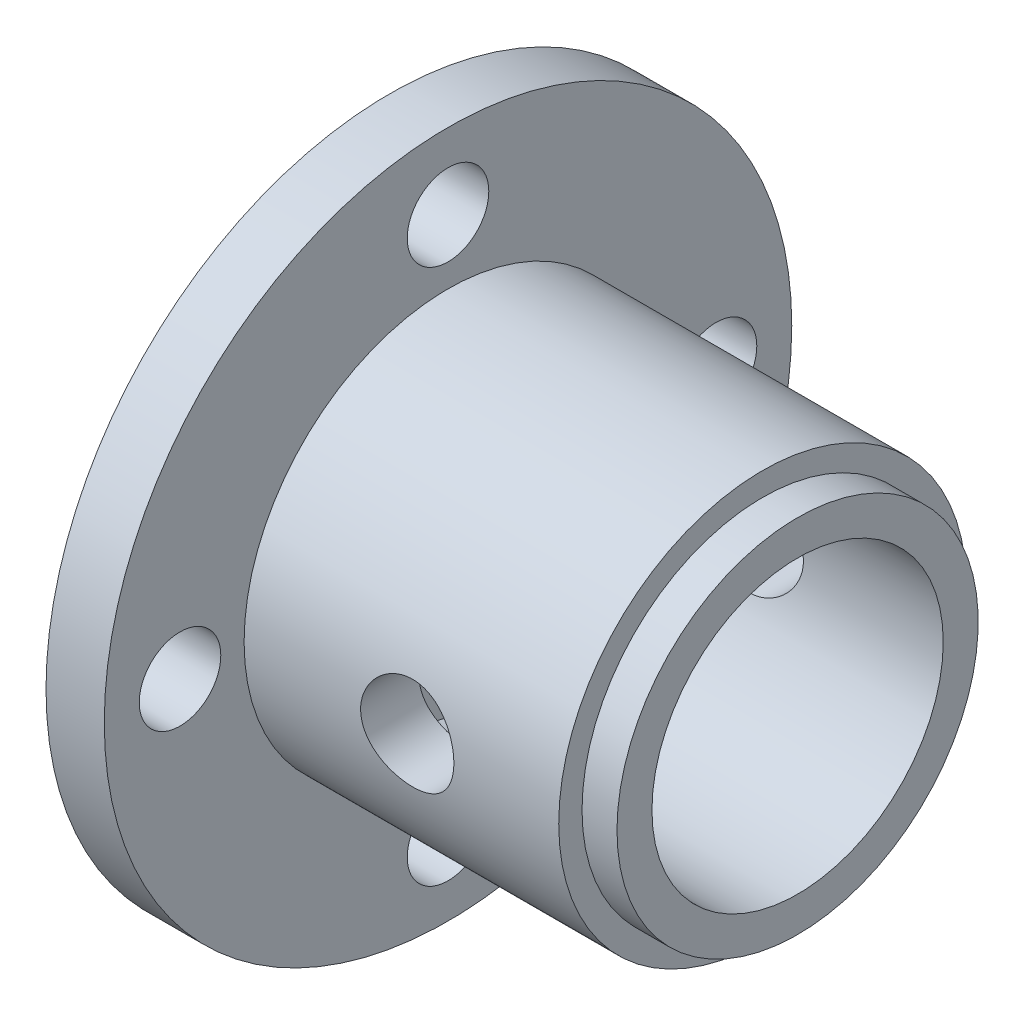
from build123d import *

# Parameters (mm, degrees)
CUT_EXTRUDE1_REACH      = 53.386
SKETCH2_R               = 3.5
CUT_EXTRUDE2_DEPTH      = 46.84212037
CUT_EXTRUDE2_DEPTH_BACK = 46.84212037
SKETCH3_R               = 4


# Read off the part's stored shape, not the designer's step: Revolve1
with BuildPart() as part:
    # Revolve1 outline → Revolve1 (revolve)
    with BuildSketch(Plane.YX):
        Polygon((0, -9), (0, -19), (7.5, -19), (7.5, -16), (29.5, -16), (29.5, -11), (17.5, -11), (17.5, 16), (15.5, 16), (15.5, 19), (12.5, 19), (12.5, -9), align=None)
    revolve(axis=Axis((0, 0, 0), (1, 0, 0)))

    # Sketch2 → Cut-Extrude1 (cut, up to next)
    with BuildSketch(Plane(origin=(-11, 0, 0), x_dir=(0, 0, -1), z_dir=(1, 0, 0)), mode=Mode.PRIVATE) as cut_extrude1_sk1:
        with Locations((0, 23)):
            Circle(SKETCH2_R)
    cut_extrude1_tool1 = extrude(cut_extrude1_sk1.sketch, amount=-CUT_EXTRUDE1_REACH, mode=Mode.PRIVATE) & part.part
    # Sketch2 → Cut-Extrude1 (cut, up to next)
    with BuildSketch(Plane(origin=(-11, 0, 0), x_dir=(0, 0, -1), z_dir=(1, 0, 0)), mode=Mode.PRIVATE) as cut_extrude1_sk2:
        with Locations((23, 0)):
            Circle(SKETCH2_R)
    cut_extrude1_tool2 = extrude(cut_extrude1_sk2.sketch, amount=-CUT_EXTRUDE1_REACH, mode=Mode.PRIVATE) & part.part
    # Sketch2 → Cut-Extrude1 (cut, up to next)
    with BuildSketch(Plane(origin=(-11, 0, 0), x_dir=(0, 0, -1), z_dir=(1, 0, 0)), mode=Mode.PRIVATE) as cut_extrude1_sk3:
        with Locations((0, -23)):
            Circle(SKETCH2_R)
    cut_extrude1_tool3 = extrude(cut_extrude1_sk3.sketch, amount=-CUT_EXTRUDE1_REACH, mode=Mode.PRIVATE) & part.part
    # Sketch2 → Cut-Extrude1 (cut, up to next)
    with BuildSketch(Plane(origin=(-11, 0, 0), x_dir=(0, 0, -1), z_dir=(1, 0, 0)), mode=Mode.PRIVATE) as cut_extrude1_sk4:
        with Locations((-23, 0)):
            Circle(SKETCH2_R)
    cut_extrude1_tool4 = extrude(cut_extrude1_sk4.sketch, amount=-CUT_EXTRUDE1_REACH, mode=Mode.PRIVATE) & part.part
    add(cut_extrude1_tool1.solids().sort_by_distance((-11, 23, 0))[0], mode=Mode.SUBTRACT)
    add(cut_extrude1_tool2.solids().sort_by_distance((-11, 0, -23))[0], mode=Mode.SUBTRACT)
    add(cut_extrude1_tool3.solids().sort_by_distance((-11, -23, 0))[0], mode=Mode.SUBTRACT)
    add(cut_extrude1_tool4.solids().sort_by_distance((-11, 0, 23))[0], mode=Mode.SUBTRACT)

    # Sketch3 → Cut-Extrude2 (cut, two sides: drawn at the far end of the back side and taken through both)
    with BuildSketch(Plane.XY.offset(-CUT_EXTRUDE2_DEPTH_BACK)):
        with Locations((3, 0)):
            Circle(SKETCH3_R)
    extrude(amount=CUT_EXTRUDE2_DEPTH + CUT_EXTRUDE2_DEPTH_BACK, mode=Mode.SUBTRACT)


solid = part.part
